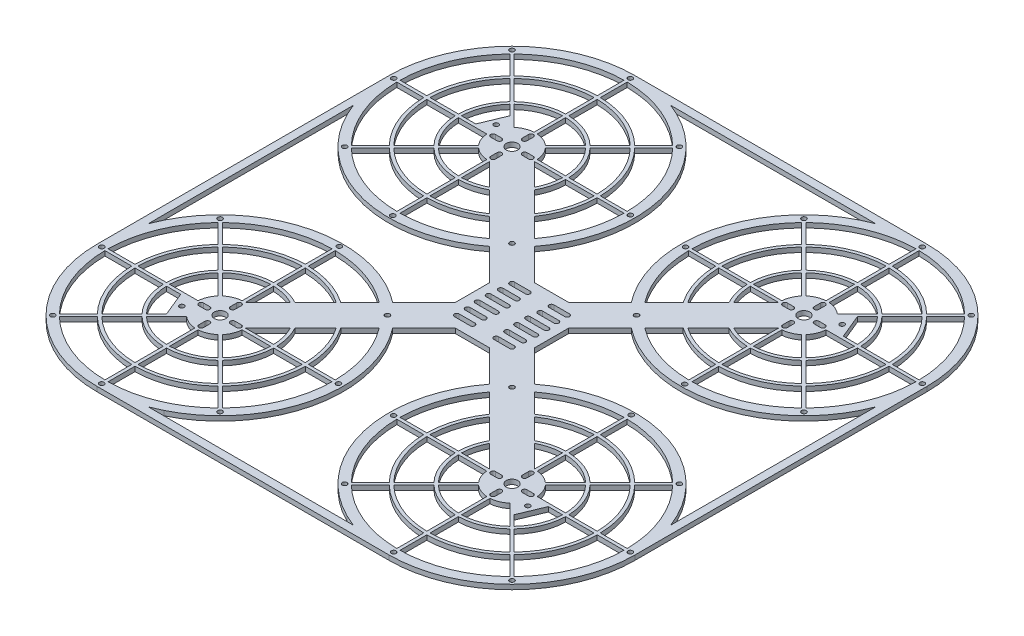
from build123d import *

# Parameters (mm, degrees)
SKETCH_1_R           = 1.5
EXTRUDE_4_DEPTH      = 3
MIRROR_1_OUTLINE_R   = 1.5
MIRROR_1_OUTLINE_R_2 = 3.65
MIRROR_1_DEPTH       = 3


# Read off the part's stored shape, not the designer's step: 镜向1
with BuildPart() as part:
    # 草图1 → 凸台-拉伸4 (new body)
    with BuildSketch(Plane(origin=(0, 0, 0), x_dir=(1, 0, 0), z_dir=(0, 1, 0))):
        with BuildLine():
            Line((67.5, -81.642135624), (67.5, -92.5))
            Line((67.5, -92.5), (92.5, -92.5))
            Line((92.5, -92.5), (92.5, -67.5))
            Line((92.5, -67.5), (81.642135624, -67.5))
            Line((81.642135624, -67.5), (61.770245137, -47.628109513))
            ThreePointArc((61.770245137, -47.628109513), (75.978863612, 17.641209829), (34.465042007, 69.972572337))
            Line((34.465042007, 69.972572337), (27.477263328, 73))
            Line((27.477263328, 73), (92.5, 73))
            Line((92.5, 73), (92.5, 78))
            Line((92.5, 78), (0, 78))
            ThreePointArc((0, 78), (-55.154328933, 55.154328933), (-78, 0))
            Line((-78, 0), (-78, -92.5))
            Line((-78, -92.5), (-73, -92.5))
            Line((-73, -92.5), (-73, -27.477263328))
            ThreePointArc((-73, -27.477263328), (-21.3292137, -75.027092726), (47.628109513, -61.770245137))
            Line((47.628109513, -61.770245137), (67.5, -81.642135624))
        make_face()
        with Locations(Location((-53.033008589, -53.033008589, 0), (0, 0, 270))):
            Circle(SKETCH_1_R, mode=Mode.SUBTRACT)
        with Locations(Location((0, -75.549453739, 0), (0, 0, 270))):
            Circle(SKETCH_1_R, mode=Mode.SUBTRACT)
        with BuildLine():
            ThreePointArc((-38.177337409, -39.591550972), (-21.04758878, -50.813374288), (-1, -54.990908339))
            Line((-1, -54.990908339), (-1, -71.993055221))
            ThreePointArc((-1, -71.993055221), (-27.55320713, -66.519326341), (-50.199670764, -51.613884326))
            Line((-50.199670764, -51.613884326), (-38.177337409, -39.591550972))
        make_face(mode=Mode.SUBTRACT)
        with BuildLine():
            Line((-71.993055221, -1), (-54.990908339, -1))
            ThreePointArc((-54.990908339, -1), (-50.813374288, -21.04758878), (-39.591550972, -38.177337409))
            Line((-39.591550972, -38.177337409), (-51.613884326, -50.199670764))
            ThreePointArc((-51.613884326, -50.199670764), (-66.519326341, -27.55320713), (-71.993055221, -1))
        make_face(mode=Mode.SUBTRACT)
        with BuildLine():
            Line((-25.445740535, -24.031526973), (-38.177094772, -36.762881209))
            ThreePointArc((-38.177094772, -36.762881209), (-48.965615223, -20.282221915), (-52.990565198, -1))
            Line((-52.990565198, -1), (-34.985711369, -1))
            ThreePointArc((-34.985711369, -1), (-32.335783638, -13.393920133), (-25.445740535, -24.031526973))
        make_face(mode=Mode.SUBTRACT)
        with BuildLine():
            ThreePointArc((-24.031526973, -25.445740535), (-13.393920133, -32.335783638), (-1, -34.985711369))
            Line((-1, -34.985711369), (-1, -52.990565198))
            ThreePointArc((-1, -52.990565198), (-20.282221915, -48.965615223), (-36.762881209, -38.177094772))
            Line((-36.762881209, -38.177094772), (-24.031526973, -25.445740535))
        make_face(mode=Mode.SUBTRACT)
        with BuildLine():
            Line((-11.290112025, -9.875898463), (-24.030914361, -22.616700798))
            ThreePointArc((-24.030914361, -22.616700798), (-30.488024573, -12.628553268), (-32.984845005, -1))
            Line((-32.984845005, -1), (-14.966629547, -1))
            ThreePointArc((-14.966629547, -1), (-13.858192988, -5.740251485), (-11.290112025, -9.875898463))
        make_face(mode=Mode.SUBTRACT)
        with BuildLine():
            ThreePointArc((-1, -32.984845005), (-12.628553268, -30.488024573), (-22.616700798, -24.030914361))
            Line((-22.616700798, -24.030914361), (-9.875898463, -11.290112025))
            ThreePointArc((-9.875898463, -11.290112025), (-5.740251485, -13.858192988), (-1, -14.966629547))
            Line((-1, -14.966629547), (-1, -32.984845005))
        make_face(mode=Mode.SUBTRACT)
        with BuildLine():
            ThreePointArc((-1.5, -8), (-1.060660172, -6.939339828), (0, -6.5))
            ThreePointArc((0, -6.5), (1.060660172, -6.939339828), (1.5, -8))
            Line((1.5, -8), (1.5, -12))
            ThreePointArc((1.5, -12), (0, -13.5), (-1.5, -12))
            Line((-1.5, -12), (-1.5, -8))
        make_face(mode=Mode.SUBTRACT)
        with BuildLine():
            Line((31.17157854, -45.313714164), (43.347182852, -57.489318476))
            ThreePointArc((43.347182852, -57.489318476), (23.32933243, -68.115653475), (1, -71.993055221))
            Line((1, -71.993055221), (1, -54.990908339))
            ThreePointArc((1, -54.990908339), (16.79775694, -52.372085712), (31.17157854, -45.313714164))
        make_face(mode=Mode.SUBTRACT)
        with BuildLine():
            ThreePointArc((74.13828427, -90.5), (72.63828427, -89), (74.13828427, -87.5))
            Line((74.13828427, -87.5), (85.86171573, -87.5))
            ThreePointArc((85.86171573, -87.5), (87.36171573, -89), (85.86171573, -90.5))
            Line((85.86171573, -90.5), (74.13828427, -90.5))
        make_face(mode=Mode.SUBTRACT)
        with BuildLine():
            ThreePointArc((74.82170617, -83.5), (73.32170617, -82), (74.82170617, -80.5))
            Line((74.82170617, -80.5), (85.17829383, -80.5))
            ThreePointArc((85.17829383, -80.5), (86.67829383, -82), (85.17829383, -83.5))
            Line((85.17829383, -83.5), (74.82170617, -83.5))
        make_face(mode=Mode.SUBTRACT)
        with BuildLine():
            ThreePointArc((75, -76.5), (73.5, -75), (75, -73.5))
            Line((75, -73.5), (85, -73.5))
            ThreePointArc((85, -73.5), (86.5, -75), (85, -76.5))
            Line((85, -76.5), (75, -76.5))
        make_face(mode=Mode.SUBTRACT)
        with Locations(Location((53.033008589, -53.033008589, 0), (0, 0, 270))):
            Circle(SKETCH_1_R, mode=Mode.SUBTRACT)
        with BuildLine():
            Line((16.646014639, -30.788150263), (29.732464627, -43.874600251))
            ThreePointArc((29.732464627, -43.874600251), (16.027984893, -50.518350134), (1, -52.990565198))
            Line((1, -52.990565198), (1, -34.985711369))
            ThreePointArc((1, -34.985711369), (9.069197207, -33.804580489), (16.646014639, -30.788150263))
        make_face(mode=Mode.SUBTRACT)
        with BuildLine():
            Line((1, -15.142135624), (15.166288146, -29.30842377))
            ThreePointArc((15.166288146, -29.30842377), (8.289525703, -31.941881028), (1, -32.984845005))
            Line((1, -32.984845005), (1, -15.142135624))
        make_face(mode=Mode.SUBTRACT)
        with BuildLine():
            ThreePointArc((32.984845005, -1), (31.941881028, -8.289525703), (29.30842377, -15.166288146))
            Line((29.30842377, -15.166288146), (15.142135624, -1))
            Line((15.142135624, -1), (32.984845005, -1))
        make_face(mode=Mode.SUBTRACT)
        with BuildLine():
            ThreePointArc((52.990565198, -1), (50.518350134, -16.027984893), (43.874600251, -29.732464627))
            Line((43.874600251, -29.732464627), (30.788150263, -16.646014639))
            ThreePointArc((30.788150263, -16.646014639), (33.804580489, -9.069197207), (34.985711369, -1))
            Line((34.985711369, -1), (52.990565198, -1))
        make_face(mode=Mode.SUBTRACT)
        with BuildLine():
            ThreePointArc((71.993055221, -1), (68.115653475, -23.32933243), (57.489318476, -43.347182852))
            Line((57.489318476, -43.347182852), (45.313714164, -31.17157854))
            ThreePointArc((45.313714164, -31.17157854), (52.372085712, -16.79775694), (54.990908339, -1))
            Line((54.990908339, -1), (71.993055221, -1))
        make_face(mode=Mode.SUBTRACT)
        with Locations(Location((-75, 0, 0), (0, 0, 270))):
            Circle(SKETCH_1_R, mode=Mode.SUBTRACT)
        with BuildLine():
            ThreePointArc((-25.445740535, 24.031526973), (-32.335783638, 13.393920133), (-34.985711369, 1))
            Line((-34.985711369, 1), (-52.990565198, 1))
            ThreePointArc((-52.990565198, 1), (-48.965615223, 20.282221915), (-38.177094772, 36.762881209))
            Line((-38.177094772, 36.762881209), (-25.445740535, 24.031526973))
        make_face(mode=Mode.SUBTRACT)
        with BuildLine():
            ThreePointArc((-39.591550972, 38.177337409), (-50.813374288, 21.04758878), (-54.990908339, 1))
            Line((-54.990908339, 1), (-71.993055221, 1))
            ThreePointArc((-71.993055221, 1), (-66.519326341, 27.55320713), (-51.613884326, 50.199670764))
            Line((-51.613884326, 50.199670764), (-39.591550972, 38.177337409))
        make_face(mode=Mode.SUBTRACT)
        with BuildLine():
            Line((-24.030914361, 22.616700798), (-17.660513193, 16.246299631))
            Line((-17.660513193, 16.246299631), (-23.975737276, 1))
            Line((-23.975737276, 1), (-32.984845005, 1))
            ThreePointArc((-32.984845005, 1), (-30.488024573, 12.628553268), (-24.030914361, 22.616700798))
        make_face(mode=Mode.SUBTRACT)
        with BuildLine():
            ThreePointArc((-8, 1.5), (-6.939339828, 1.060660172), (-6.5, 0))
            ThreePointArc((-6.5, 0), (-6.939339828, -1.060660172), (-8, -1.5))
            Line((-8, -1.5), (-12, -1.5))
            ThreePointArc((-12, -1.5), (-13.5, 0), (-12, 1.5))
            Line((-12, 1.5), (-8, 1.5))
        make_face(mode=Mode.SUBTRACT)
        with BuildLine():
            ThreePointArc((3.65, 0), (2.580939751, -2.580939751), (0, -3.65))
            ThreePointArc((0, -3.65), (-2.580939751, -2.580939751), (-3.65, 0))
            ThreePointArc((-3.65, 0), (-2.580939751, 2.580939751), (0, 3.65))
            ThreePointArc((0, 3.65), (2.580939751, 2.580939751), (3.65, 0))
        make_face(mode=Mode.SUBTRACT)
        with BuildLine():
            ThreePointArc((1.5, 8), (1.060660172, 6.939339828), (0, 6.5))
            ThreePointArc((0, 6.5), (-1.060660172, 6.939339828), (-1.5, 8))
            Line((-1.5, 8), (-1.5, 12))
            ThreePointArc((-1.5, 12), (0, 13.5), (1.5, 12))
            Line((1.5, 12), (1.5, 8))
        make_face(mode=Mode.SUBTRACT)
        with BuildLine():
            ThreePointArc((-1, 14.966629547), (-5.740251485, 13.858192988), (-9.875898463, 11.290112025))
            Line((-9.875898463, 11.290112025), (-22.616700798, 24.030914361))
            ThreePointArc((-22.616700798, 24.030914361), (-12.628553268, 30.488024573), (-1, 32.984845005))
            Line((-1, 32.984845005), (-1, 14.966629547))
        make_face(mode=Mode.SUBTRACT)
        with Locations(Location((-53.033008589, 53.033008589, 0), (0, 0, 270))):
            Circle(SKETCH_1_R, mode=Mode.SUBTRACT)
        with BuildLine():
            Line((-1, 52.990565198), (-1, 34.985711369))
            ThreePointArc((-1, 34.985711369), (-13.393920133, 32.335783638), (-24.031526973, 25.445740535))
            Line((-24.031526973, 25.445740535), (-36.762881209, 38.177094772))
            ThreePointArc((-36.762881209, 38.177094772), (-20.282221915, 48.965615223), (-1, 52.990565198))
        make_face(mode=Mode.SUBTRACT)
        with BuildLine():
            Line((-1, 71.993055221), (-1, 54.990908339))
            ThreePointArc((-1, 54.990908339), (-21.04758878, 50.813374288), (-38.177337409, 39.591550972))
            Line((-38.177337409, 39.591550972), (-50.199670764, 51.613884326))
            ThreePointArc((-50.199670764, 51.613884326), (-27.55320713, 66.519326341), (-1, 71.993055221))
        make_face(mode=Mode.SUBTRACT)
        with Locations(Location((0, 75, 0), (0, 0, 270))):
            Circle(SKETCH_1_R, mode=Mode.SUBTRACT)
        with BuildLine():
            ThreePointArc((8, -1.5), (6.939339828, -1.060660172), (6.5, 0))
            ThreePointArc((6.5, 0), (6.939339828, 1.060660172), (8, 1.5))
            Line((8, 1.5), (12, 1.5))
            ThreePointArc((12, 1.5), (13.5, 0), (12, -1.5))
            Line((12, -1.5), (8, -1.5))
        make_face(mode=Mode.SUBTRACT)
        with BuildLine():
            ThreePointArc((14.966629547, 1), (13.858192988, 5.740251485), (11.290112025, 9.875898463))
            Line((11.290112025, 9.875898463), (24.030914361, 22.616700798))
            ThreePointArc((24.030914361, 22.616700798), (30.488024573, 12.628553268), (32.984845005, 1))
            Line((32.984845005, 1), (14.966629547, 1))
        make_face(mode=Mode.SUBTRACT)
        with BuildLine():
            ThreePointArc((1, 32.984845005), (12.628553268, 30.488024573), (22.616700798, 24.030914361))
            Line((22.616700798, 24.030914361), (9.875898463, 11.290112025))
            ThreePointArc((9.875898463, 11.290112025), (5.740251485, 13.858192988), (1, 14.966629547))
            Line((1, 14.966629547), (1, 32.984845005))
        make_face(mode=Mode.SUBTRACT)
        with BuildLine():
            Line((52.990565198, 1), (34.985711369, 1))
            ThreePointArc((34.985711369, 1), (32.335783638, 13.393920133), (25.445740535, 24.031526973))
            Line((25.445740535, 24.031526973), (38.177094772, 36.762881209))
            ThreePointArc((38.177094772, 36.762881209), (48.965615223, 20.282221915), (52.990565198, 1))
        make_face(mode=Mode.SUBTRACT)
        with Locations(Location((75, 0, 0), (0, 0, 270))):
            Circle(SKETCH_1_R, mode=Mode.SUBTRACT)
        with BuildLine():
            Line((71.993055221, 1), (54.990908339, 1))
            ThreePointArc((54.990908339, 1), (50.813374288, 21.04758878), (39.591550972, 38.177337409))
            Line((39.591550972, 38.177337409), (51.613884326, 50.199670764))
            ThreePointArc((51.613884326, 50.199670764), (66.519326341, 27.55320713), (71.993055221, 1))
        make_face(mode=Mode.SUBTRACT)
        with BuildLine():
            ThreePointArc((1, 52.990565198), (20.282221915, 48.965615223), (36.762881209, 38.177094772))
            Line((36.762881209, 38.177094772), (24.031526973, 25.445740535))
            ThreePointArc((24.031526973, 25.445740535), (13.393920133, 32.335783638), (1, 34.985711369))
            Line((1, 34.985711369), (1, 52.990565198))
        make_face(mode=Mode.SUBTRACT)
        with BuildLine():
            Line((1, 54.990908339), (1, 71.993055221))
            ThreePointArc((1, 71.993055221), (27.55320713, 66.519326341), (50.199670764, 51.613884326))
            Line((50.199670764, 51.613884326), (38.177337409, 39.591550972))
            ThreePointArc((38.177337409, 39.591550972), (21.04758878, 50.813374288), (1, 54.990908339))
        make_face(mode=Mode.SUBTRACT)
        with Locations(Location((53.033008589, 53.033008589, 0), (0, 0, 270))):
            Circle(SKETCH_1_R, mode=Mode.SUBTRACT)
        with Locations(Location((-17.122607104, 7.092416086, 0), (0, 0, 270))):
            Circle(SKETCH_1_R, mode=Mode.SUBTRACT)
    extrude(amount=EXTRUDE_4_DEPTH)

    # 镜向1 outline → 镜向1 (add)
    with BuildSketch(Plane(origin=(0, 0, 0), x_dir=(1, 0, 0), z_dir=(0, 1, 0))):
        with BuildLine():
            Line((92.5, 73), (157.522736672, 73))
            Line((157.522736672, 73), (150.534957993, 69.972572337))
            ThreePointArc((150.534957993, 69.972572337), (109.021136388, 17.641209828), (123.229754863, -47.628109513))
            Line((123.229754863, -47.628109513), (103.357864376, -67.5))
            Line((103.357864376, -67.5), (92.5, -67.5))
            Line((92.5, -67.5), (92.5, -92.5))
            Line((92.5, -92.5), (67.5, -92.5))
            Line((67.5, -92.5), (67.5, -103.357864376))
            Line((67.5, -103.357864376), (47.628109513, -123.229754863))
            ThreePointArc((47.628109513, -123.229754863), (-21.3292137, -109.972907274), (-73, -157.522736672))
            Line((-73, -157.522736672), (-73, -92.5))
            Line((-73, -92.5), (-78, -92.5))
            Line((-78, -92.5), (-78, -185))
            ThreePointArc((-78, -185), (-55.154328933, -240.154328933), (0, -263))
            Line((0, -263), (185, -263))
            ThreePointArc((185, -263), (240.154328933, -240.154328933), (263, -185))
            Line((263, -185), (263, 0))
            ThreePointArc((263, 0), (240.154328933, 55.154328933), (185, 78))
            Line((185, 78), (92.5, 78))
            Line((92.5, 78), (92.5, 73))
        make_face()
        with Locations((-53.033008589, -238.033008589)):
            Circle(MIRROR_1_OUTLINE_R, mode=Mode.SUBTRACT)
        with Locations((0, -260)):
            Circle(MIRROR_1_OUTLINE_R, mode=Mode.SUBTRACT)
        with BuildLine():
            Line((-1, -239.990908339), (-1, -256.993055221))
            ThreePointArc((-1, -256.993055221), (-27.55320713, -251.519326341), (-50.199670764, -236.613884326))
            Line((-50.199670764, -236.613884326), (-38.177337409, -224.591550972))
            ThreePointArc((-38.177337409, -224.591550972), (-21.04758878, -235.813374288), (-1, -239.990908339))
        make_face(mode=Mode.SUBTRACT)
        with BuildLine():
            Line((-1, -219.985711369), (-1, -237.990565198))
            ThreePointArc((-1, -237.990565198), (-20.282221915, -233.965615223), (-36.762881209, -223.177094772))
            Line((-36.762881209, -223.177094772), (-24.031526973, -210.445740535))
            ThreePointArc((-24.031526973, -210.445740535), (-13.393920133, -217.335783638), (-1, -219.985711369))
        make_face(mode=Mode.SUBTRACT)
        with BuildLine():
            ThreePointArc((-51.613884326, -235.199670764), (-66.519326341, -212.55320713), (-71.993055221, -186))
            Line((-71.993055221, -186), (-54.990908339, -186))
            ThreePointArc((-54.990908339, -186), (-50.813374288, -206.04758878), (-39.591550972, -223.177337409))
            Line((-39.591550972, -223.177337409), (-51.613884326, -235.199670764))
        make_face(mode=Mode.SUBTRACT)
        with BuildLine():
            ThreePointArc((-38.177094772, -221.762881209), (-48.965615223, -205.282221915), (-52.990565198, -186))
            Line((-52.990565198, -186), (-34.985711369, -186))
            ThreePointArc((-34.985711369, -186), (-32.335783638, -198.393920133), (-25.445740535, -209.031526973))
            Line((-25.445740535, -209.031526973), (-38.177094772, -221.762881209))
        make_face(mode=Mode.SUBTRACT)
        with Locations((-75, -185)):
            Circle(MIRROR_1_OUTLINE_R, mode=Mode.SUBTRACT)
        with BuildLine():
            Line((-1, -199.966629547), (-1, -217.984845005))
            ThreePointArc((-1, -217.984845005), (-12.628553268, -215.488024573), (-22.616700798, -209.030914361))
            Line((-22.616700798, -209.030914361), (-9.875898463, -196.290112025))
            ThreePointArc((-9.875898463, -196.290112025), (-5.740251486, -198.858192988), (-1, -199.966629547))
        make_face(mode=Mode.SUBTRACT)
        with BuildLine():
            Line((-17.660513193, -201.246299631), (-24.030914361, -207.616700798))
            ThreePointArc((-24.030914361, -207.616700798), (-30.488024573, -197.628553268), (-32.984845005, -186))
            Line((-32.984845005, -186), (-23.975737276, -186))
            Line((-23.975737276, -186), (-17.660513193, -201.246299631))
        make_face(mode=Mode.SUBTRACT)
        with Locations((-17.122607104, -192.092416086)):
            Circle(MIRROR_1_OUTLINE_R, mode=Mode.SUBTRACT)
        with BuildLine():
            ThreePointArc((-1.5, -193), (0, -191.5), (1.5, -193))
            Line((1.5, -193), (1.5, -197))
            ThreePointArc((1.5, -197), (0, -198.5), (-1.5, -197))
            Line((-1.5, -197), (-1.5, -193))
        make_face(mode=Mode.SUBTRACT)
        with BuildLine():
            ThreePointArc((-12, -186.5), (-13.5, -185), (-12, -183.5))
            Line((-12, -183.5), (-8, -183.5))
            ThreePointArc((-8, -183.5), (-6.5, -185), (-8, -186.5))
            Line((-8, -186.5), (-12, -186.5))
        make_face(mode=Mode.SUBTRACT)
        with Locations((0, -185)):
            Circle(MIRROR_1_OUTLINE_R_2, mode=Mode.SUBTRACT)
        with BuildLine():
            Line((1, -256.993055221), (1, -239.990908339))
            ThreePointArc((1, -239.990908339), (21.04758878, -235.813374288), (38.177337409, -224.591550972))
            Line((38.177337409, -224.591550972), (50.199670764, -236.613884326))
            ThreePointArc((50.199670764, -236.613884326), (27.55320713, -251.519326341), (1, -256.993055221))
        make_face(mode=Mode.SUBTRACT)
        with BuildLine():
            Line((1, -237.990565198), (1, -219.985711369))
            ThreePointArc((1, -219.985711369), (13.393920133, -217.335783638), (24.031526973, -210.445740535))
            Line((24.031526973, -210.445740535), (36.762881209, -223.177094772))
            ThreePointArc((36.762881209, -223.177094772), (20.282221915, -233.965615223), (1, -237.990565198))
        make_face(mode=Mode.SUBTRACT)
        with Locations((53.033008589, -238.033008589)):
            Circle(MIRROR_1_OUTLINE_R, mode=Mode.SUBTRACT)
        with BuildLine():
            Line((1, -217.984845005), (1, -199.966629547))
            ThreePointArc((1, -199.966629547), (5.740251486, -198.858192988), (9.875898463, -196.290112025))
            Line((9.875898463, -196.290112025), (22.616700798, -209.030914361))
            ThreePointArc((22.616700798, -209.030914361), (12.628553268, -215.488024573), (1, -217.984845005))
        make_face(mode=Mode.SUBTRACT)
        with BuildLine():
            Line((34.985711369, -186), (52.990565198, -186))
            ThreePointArc((52.990565198, -186), (48.965615223, -205.282221915), (38.177094772, -221.762881209))
            Line((38.177094772, -221.762881209), (25.445740535, -209.031526973))
            ThreePointArc((25.445740535, -209.031526973), (32.335783638, -198.393920133), (34.985711369, -186))
        make_face(mode=Mode.SUBTRACT)
        with BuildLine():
            Line((14.966629547, -186), (32.984845005, -186))
            ThreePointArc((32.984845005, -186), (30.488024573, -197.628553268), (24.030914361, -207.616700798))
            Line((24.030914361, -207.616700798), (11.290112025, -194.875898463))
            ThreePointArc((11.290112025, -194.875898463), (13.858192988, -190.740251486), (14.966629547, -186))
        make_face(mode=Mode.SUBTRACT)
        with BuildLine():
            Line((8, -183.5), (12, -183.5))
            ThreePointArc((12, -183.5), (13.5, -185), (12, -186.5))
            Line((12, -186.5), (8, -186.5))
            ThreePointArc((8, -186.5), (6.5, -185), (8, -183.5))
        make_face(mode=Mode.SUBTRACT)
        with BuildLine():
            Line((54.990908339, -186), (71.993055221, -186))
            ThreePointArc((71.993055221, -186), (66.519326341, -212.55320713), (51.613884326, -235.199670764))
            Line((51.613884326, -235.199670764), (39.591550972, -223.177337409))
            ThreePointArc((39.591550972, -223.177337409), (50.813374288, -206.04758878), (54.990908339, -186))
        make_face(mode=Mode.SUBTRACT)
        with Locations((75, -185)):
            Circle(MIRROR_1_OUTLINE_R, mode=Mode.SUBTRACT)
        with BuildLine():
            Line((-54.990908339, -184), (-71.993055221, -184))
            ThreePointArc((-71.993055221, -184), (-66.519326341, -157.44679287), (-51.613884326, -134.800329236))
            Line((-51.613884326, -134.800329236), (-39.591550972, -146.822662591))
            ThreePointArc((-39.591550972, -146.822662591), (-50.813374288, -163.95241122), (-54.990908339, -184))
        make_face(mode=Mode.SUBTRACT)
        with BuildLine():
            Line((-34.985711369, -184), (-52.990565198, -184))
            ThreePointArc((-52.990565198, -184), (-48.965615223, -164.717778085), (-38.177094772, -148.237118791))
            Line((-38.177094772, -148.237118791), (-25.445740535, -160.968473027))
            ThreePointArc((-25.445740535, -160.968473027), (-32.335783638, -171.606079867), (-34.985711369, -184))
        make_face(mode=Mode.SUBTRACT)
        with BuildLine():
            Line((-14.966629547, -184), (-32.984845005, -184))
            ThreePointArc((-32.984845005, -184), (-30.488024573, -172.371446732), (-24.030914361, -162.383299202))
            Line((-24.030914361, -162.383299202), (-11.290112025, -175.124101537))
            ThreePointArc((-11.290112025, -175.124101537), (-13.858192988, -179.259748514), (-14.966629547, -184))
        make_face(mode=Mode.SUBTRACT)
        with BuildLine():
            ThreePointArc((-1.5, -173), (0, -171.5), (1.5, -173))
            Line((1.5, -173), (1.5, -177))
            ThreePointArc((1.5, -177), (0, -178.5), (-1.5, -177))
            Line((-1.5, -177), (-1.5, -173))
        make_face(mode=Mode.SUBTRACT)
        with BuildLine():
            ThreePointArc((-22.616700798, -160.969085639), (-12.628553268, -154.511975427), (-1, -152.015154995))
            Line((-1, -152.015154995), (-1, -170.033370453))
            ThreePointArc((-1, -170.033370453), (-5.740251486, -171.141807012), (-9.875898463, -173.709887975))
            Line((-9.875898463, -173.709887975), (-22.616700798, -160.969085639))
        make_face(mode=Mode.SUBTRACT)
        with BuildLine():
            ThreePointArc((-36.762881209, -146.822905228), (-20.282221915, -136.034384777), (-1, -132.009434802))
            Line((-1, -132.009434802), (-1, -150.014288631))
            ThreePointArc((-1, -150.014288631), (-13.393920133, -152.664216362), (-24.031526973, -159.554259465))
            Line((-24.031526973, -159.554259465), (-36.762881209, -146.822905228))
        make_face(mode=Mode.SUBTRACT)
        with Locations((-53.033008589, -131.966991411)):
            Circle(MIRROR_1_OUTLINE_R, mode=Mode.SUBTRACT)
        with BuildLine():
            ThreePointArc((-50.199670764, -133.386115674), (-27.55320713, -118.480673659), (-1, -113.006944779))
            Line((-1, -113.006944779), (-1, -130.009091661))
            ThreePointArc((-1, -130.009091661), (-21.04758878, -134.186625712), (-38.177337409, -145.408449028))
            Line((-38.177337409, -145.408449028), (-50.199670764, -133.386115674))
        make_face(mode=Mode.SUBTRACT)
        with Locations((0, -109.450546261)):
            Circle(MIRROR_1_OUTLINE_R, mode=Mode.SUBTRACT)
        with BuildLine():
            Line((15.142135624, -184), (29.30842377, -169.833711854))
            ThreePointArc((29.30842377, -169.833711854), (31.941881028, -176.710474297), (32.984845005, -184))
            Line((32.984845005, -184), (15.142135624, -184))
        make_face(mode=Mode.SUBTRACT)
        with BuildLine():
            Line((1, -169.857864376), (1, -152.015154995))
            ThreePointArc((1, -152.015154995), (8.289525703, -153.058118972), (15.166288146, -155.69157623))
            Line((15.166288146, -155.69157623), (1, -169.857864376))
        make_face(mode=Mode.SUBTRACT)
        with BuildLine():
            ThreePointArc((43.874600251, -155.267535373), (50.518350134, -168.972015107), (52.990565198, -184))
            Line((52.990565198, -184), (34.985711369, -184))
            ThreePointArc((34.985711369, -184), (33.804580489, -175.930802793), (30.788150263, -168.353985361))
            Line((30.788150263, -168.353985361), (43.874600251, -155.267535373))
        make_face(mode=Mode.SUBTRACT)
        with BuildLine():
            Line((1, -150.014288631), (1, -132.009434802))
            ThreePointArc((1, -132.009434802), (16.027984893, -134.481649866), (29.732464627, -141.125399749))
            Line((29.732464627, -141.125399749), (16.646014639, -154.211849737))
            ThreePointArc((16.646014639, -154.211849737), (9.069197207, -151.195419511), (1, -150.014288631))
        make_face(mode=Mode.SUBTRACT)
        with BuildLine():
            ThreePointArc((57.489318476, -141.652817148), (68.115653475, -161.67066757), (71.993055221, -184))
            Line((71.993055221, -184), (54.990908339, -184))
            ThreePointArc((54.990908339, -184), (52.372085712, -168.20224306), (45.313714164, -153.82842146))
            Line((45.313714164, -153.82842146), (57.489318476, -141.652817148))
        make_face(mode=Mode.SUBTRACT)
        with BuildLine():
            Line((1, -130.009091661), (1, -113.006944779))
            ThreePointArc((1, -113.006944779), (23.32933243, -116.884346525), (43.347182852, -127.510681524))
            Line((43.347182852, -127.510681524), (31.17157854, -139.686285836))
            ThreePointArc((31.17157854, -139.686285836), (16.79775694, -132.627914288), (1, -130.009091661))
        make_face(mode=Mode.SUBTRACT)
        with Locations((53.033008589, -131.966991411)):
            Circle(MIRROR_1_OUTLINE_R, mode=Mode.SUBTRACT)
        with BuildLine():
            Line((75, -108.5), (85, -108.5))
            ThreePointArc((85, -108.5), (86.5, -110), (85, -111.5))
            Line((85, -111.5), (75, -111.5))
            ThreePointArc((75, -111.5), (73.5, -110), (75, -108.5))
        make_face(mode=Mode.SUBTRACT)
        with BuildLine():
            Line((74.82170617, -101.5), (85.17829383, -101.5))
            ThreePointArc((85.17829383, -101.5), (86.67829383, -103), (85.17829383, -104.5))
            Line((85.17829383, -104.5), (74.82170617, -104.5))
            ThreePointArc((74.82170617, -104.5), (73.32170617, -103), (74.82170617, -101.5))
        make_face(mode=Mode.SUBTRACT)
        with BuildLine():
            Line((74.13828427, -94.5), (85.86171573, -94.5))
            ThreePointArc((85.86171573, -94.5), (87.36171573, -96), (85.86171573, -97.5))
            Line((85.86171573, -97.5), (74.13828427, -97.5))
            ThreePointArc((74.13828427, -97.5), (72.63828427, -96), (74.13828427, -94.5))
        make_face(mode=Mode.SUBTRACT)
        with Locations((131.966991411, -238.033008589)):
            Circle(MIRROR_1_OUTLINE_R, mode=Mode.SUBTRACT)
        with BuildLine():
            ThreePointArc((146.822662591, -224.591550972), (163.95241122, -235.813374288), (184, -239.990908339))
            Line((184, -239.990908339), (184, -256.993055221))
            ThreePointArc((184, -256.993055221), (157.44679287, -251.519326341), (134.800329236, -236.613884326))
            Line((134.800329236, -236.613884326), (146.822662591, -224.591550972))
        make_face(mode=Mode.SUBTRACT)
        with BuildLine():
            ThreePointArc((160.968473027, -210.445740535), (171.606079867, -217.335783638), (184, -219.985711369))
            Line((184, -219.985711369), (184, -237.990565198))
            ThreePointArc((184, -237.990565198), (164.717778085, -233.965615223), (148.237118791, -223.177094772))
            Line((148.237118791, -223.177094772), (160.968473027, -210.445740535))
        make_face(mode=Mode.SUBTRACT)
        with BuildLine():
            ThreePointArc((133.386115674, -235.199670764), (118.480673659, -212.55320713), (113.006944779, -186))
            Line((113.006944779, -186), (130.009091661, -186))
            ThreePointArc((130.009091661, -186), (134.186625712, -206.04758878), (145.408449028, -223.177337409))
            Line((145.408449028, -223.177337409), (133.386115674, -235.199670764))
        make_face(mode=Mode.SUBTRACT)
        with BuildLine():
            Line((81.642135624, -117.5), (103.357864376, -117.5))
            Line((103.357864376, -117.5), (123.229754863, -137.371890487))
            ThreePointArc((123.229754863, -137.371890487), (109.021136388, -202.641209828), (150.534957993, -254.972572337))
            Line((150.534957993, -254.972572337), (157.522736672, -258))
            Line((157.522736672, -258), (27.477263328, -258))
            Line((27.477263328, -258), (34.465042007, -254.972572337))
            ThreePointArc((34.465042007, -254.972572337), (75.978863612, -202.641209828), (61.770245137, -137.371890487))
            Line((61.770245137, -137.371890487), (81.642135624, -117.5))
        make_face(mode=Mode.SUBTRACT)
        with Locations((110, -185)):
            Circle(MIRROR_1_OUTLINE_R, mode=Mode.SUBTRACT)
        with BuildLine():
            ThreePointArc((146.822905228, -221.762881209), (136.034384777, -205.282221915), (132.009434802, -186))
            Line((132.009434802, -186), (150.014288631, -186))
            ThreePointArc((150.014288631, -186), (152.664216362, -198.393920133), (159.554259465, -209.031526973))
            Line((159.554259465, -209.031526973), (146.822905228, -221.762881209))
        make_face(mode=Mode.SUBTRACT)
        with BuildLine():
            ThreePointArc((175.124101537, -196.290112025), (179.259748514, -198.858192988), (184, -199.966629547))
            Line((184, -199.966629547), (184, -217.984845005))
            ThreePointArc((184, -217.984845005), (172.371446732, -215.488024573), (162.383299202, -209.030914361))
            Line((162.383299202, -209.030914361), (175.124101537, -196.290112025))
        make_face(mode=Mode.SUBTRACT)
        with BuildLine():
            ThreePointArc((160.969085639, -207.616700798), (154.511975427, -197.628553268), (152.015154995, -186))
            Line((152.015154995, -186), (170.033370453, -186))
            ThreePointArc((170.033370453, -186), (171.141807012, -190.740251486), (173.709887975, -194.875898463))
            Line((173.709887975, -194.875898463), (160.969085639, -207.616700798))
        make_face(mode=Mode.SUBTRACT)
        with BuildLine():
            ThreePointArc((173, -186.5), (171.5, -185), (173, -183.5))
            Line((173, -183.5), (177, -183.5))
            ThreePointArc((177, -183.5), (178.5, -185), (177, -186.5))
            Line((177, -186.5), (173, -186.5))
        make_face(mode=Mode.SUBTRACT)
        with Locations((185, -260)):
            Circle(MIRROR_1_OUTLINE_R, mode=Mode.SUBTRACT)
        with BuildLine():
            Line((223.177337409, -224.591550972), (235.199670764, -236.613884326))
            ThreePointArc((235.199670764, -236.613884326), (212.55320713, -251.519326341), (186, -256.993055221))
            Line((186, -256.993055221), (186, -239.990908339))
            ThreePointArc((186, -239.990908339), (206.04758878, -235.813374288), (223.177337409, -224.591550972))
        make_face(mode=Mode.SUBTRACT)
        with BuildLine():
            Line((209.031526973, -210.445740535), (221.762881209, -223.177094772))
            ThreePointArc((221.762881209, -223.177094772), (205.282221915, -233.965615223), (186, -237.990565198))
            Line((186, -237.990565198), (186, -219.985711369))
            ThreePointArc((186, -219.985711369), (198.393920133, -217.335783638), (209.031526973, -210.445740535))
        make_face(mode=Mode.SUBTRACT)
        with Locations((238.033008589, -238.033008589)):
            Circle(MIRROR_1_OUTLINE_R, mode=Mode.SUBTRACT)
        with BuildLine():
            Line((194.875898463, -196.290112025), (207.616700798, -209.030914361))
            ThreePointArc((207.616700798, -209.030914361), (197.628553268, -215.488024573), (186, -217.984845005))
            Line((186, -217.984845005), (186, -199.966629547))
            ThreePointArc((186, -199.966629547), (190.740251486, -198.858192988), (194.875898463, -196.290112025))
        make_face(mode=Mode.SUBTRACT)
        with BuildLine():
            Line((183.5, -197), (183.5, -193))
            ThreePointArc((183.5, -193), (185, -191.5), (186.5, -193))
            Line((186.5, -193), (186.5, -197))
            ThreePointArc((186.5, -197), (185, -198.5), (183.5, -197))
        make_face(mode=Mode.SUBTRACT)
        with Locations((185, -185)):
            Circle(MIRROR_1_OUTLINE_R_2, mode=Mode.SUBTRACT)
        with BuildLine():
            Line((193, -183.5), (197, -183.5))
            ThreePointArc((197, -183.5), (198.5, -185), (197, -186.5))
            Line((197, -186.5), (193, -186.5))
            ThreePointArc((193, -186.5), (191.5, -185), (193, -183.5))
        make_face(mode=Mode.SUBTRACT)
        with Locations((202.122607104, -192.092416086)):
            Circle(MIRROR_1_OUTLINE_R, mode=Mode.SUBTRACT)
        with BuildLine():
            ThreePointArc((217.984845005, -186), (215.488024573, -197.628553268), (209.030914361, -207.616700798))
            Line((209.030914361, -207.616700798), (202.660513193, -201.246299631))
            Line((202.660513193, -201.246299631), (208.975737276, -186))
            Line((208.975737276, -186), (217.984845005, -186))
        make_face(mode=Mode.SUBTRACT)
        with BuildLine():
            ThreePointArc((256.993055221, -186), (251.519326341, -212.55320713), (236.613884326, -235.199670764))
            Line((236.613884326, -235.199670764), (224.591550972, -223.177337409))
            ThreePointArc((224.591550972, -223.177337409), (235.813374288, -206.04758878), (239.990908339, -186))
            Line((239.990908339, -186), (256.993055221, -186))
        make_face(mode=Mode.SUBTRACT)
        with BuildLine():
            ThreePointArc((237.990565198, -186), (233.965615223, -205.282221915), (223.177094772, -221.762881209))
            Line((223.177094772, -221.762881209), (210.445740535, -209.031526973))
            ThreePointArc((210.445740535, -209.031526973), (217.335783638, -198.393920133), (219.985711369, -186))
            Line((219.985711369, -186), (237.990565198, -186))
        make_face(mode=Mode.SUBTRACT)
        with Locations((260, -185)):
            Circle(MIRROR_1_OUTLINE_R, mode=Mode.SUBTRACT)
        with BuildLine():
            ThreePointArc((113.006944779, -184), (116.884346525, -161.67066757), (127.510681524, -141.652817148))
            Line((127.510681524, -141.652817148), (139.686285836, -153.82842146))
            ThreePointArc((139.686285836, -153.82842146), (132.627914288, -168.20224306), (130.009091661, -184))
            Line((130.009091661, -184), (113.006944779, -184))
        make_face(mode=Mode.SUBTRACT)
        with BuildLine():
            ThreePointArc((132.009434802, -184), (134.481649866, -168.972015107), (141.125399749, -155.267535373))
            Line((141.125399749, -155.267535373), (154.211849737, -168.353985361))
            ThreePointArc((154.211849737, -168.353985361), (151.195419511, -175.930802793), (150.014288631, -184))
            Line((150.014288631, -184), (132.009434802, -184))
        make_face(mode=Mode.SUBTRACT)
        with BuildLine():
            ThreePointArc((152.015154995, -184), (153.058118972, -176.710474297), (155.69157623, -169.833711854))
            Line((155.69157623, -169.833711854), (169.857864376, -184))
            Line((169.857864376, -184), (152.015154995, -184))
        make_face(mode=Mode.SUBTRACT)
        with BuildLine():
            Line((184, -169.857864376), (169.833711854, -155.69157623))
            ThreePointArc((169.833711854, -155.69157623), (176.710474297, -153.058118972), (184, -152.015154995))
            Line((184, -152.015154995), (184, -169.857864376))
        make_face(mode=Mode.SUBTRACT)
        with BuildLine():
            Line((168.353985361, -154.211849737), (155.267535373, -141.125399749))
            ThreePointArc((155.267535373, -141.125399749), (168.972015107, -134.481649866), (184, -132.009434802))
            Line((184, -132.009434802), (184, -150.014288631))
            ThreePointArc((184, -150.014288631), (175.930802793, -151.195419511), (168.353985361, -154.211849737))
        make_face(mode=Mode.SUBTRACT)
        with Locations((131.966991411, -131.966991411)):
            Circle(MIRROR_1_OUTLINE_R, mode=Mode.SUBTRACT)
        with BuildLine():
            Line((110, -111.5), (100, -111.5))
            ThreePointArc((100, -111.5), (98.5, -110), (100, -108.5))
            Line((100, -108.5), (110, -108.5))
            ThreePointArc((110, -108.5), (111.5, -110), (110, -111.5))
        make_face(mode=Mode.SUBTRACT)
        with BuildLine():
            Line((110.17829383, -104.5), (99.82170617, -104.5))
            ThreePointArc((99.82170617, -104.5), (98.32170617, -103), (99.82170617, -101.5))
            Line((99.82170617, -101.5), (110.17829383, -101.5))
            ThreePointArc((110.17829383, -101.5), (111.67829383, -103), (110.17829383, -104.5))
        make_face(mode=Mode.SUBTRACT)
        with BuildLine():
            Line((110.86171573, -97.5), (99.13828427, -97.5))
            ThreePointArc((99.13828427, -97.5), (97.63828427, -96), (99.13828427, -94.5))
            Line((99.13828427, -94.5), (110.86171573, -94.5))
            ThreePointArc((110.86171573, -94.5), (112.36171573, -96), (110.86171573, -97.5))
        make_face(mode=Mode.SUBTRACT)
        with BuildLine():
            Line((153.82842146, -139.686285836), (141.652817148, -127.510681524))
            ThreePointArc((141.652817148, -127.510681524), (161.67066757, -116.884346525), (184, -113.006944779))
            Line((184, -113.006944779), (184, -130.009091661))
            ThreePointArc((184, -130.009091661), (168.20224306, -132.627914288), (153.82842146, -139.686285836))
        make_face(mode=Mode.SUBTRACT)
        with BuildLine():
            Line((183.5, -177), (183.5, -173))
            ThreePointArc((183.5, -173), (185, -171.5), (186.5, -173))
            Line((186.5, -173), (186.5, -177))
            ThreePointArc((186.5, -177), (185, -178.5), (183.5, -177))
        make_face(mode=Mode.SUBTRACT)
        with BuildLine():
            Line((186, -170.033370453), (186, -152.015154995))
            ThreePointArc((186, -152.015154995), (197.628553268, -154.511975427), (207.616700798, -160.969085639))
            Line((207.616700798, -160.969085639), (194.875898463, -173.709887975))
            ThreePointArc((194.875898463, -173.709887975), (190.740251486, -171.141807012), (186, -170.033370453))
        make_face(mode=Mode.SUBTRACT)
        with BuildLine():
            ThreePointArc((209.030914361, -162.383299202), (215.488024573, -172.371446732), (217.984845005, -184))
            Line((217.984845005, -184), (199.966629547, -184))
            ThreePointArc((199.966629547, -184), (198.858192988, -179.259748514), (196.290112025, -175.124101537))
            Line((196.290112025, -175.124101537), (209.030914361, -162.383299202))
        make_face(mode=Mode.SUBTRACT)
        with BuildLine():
            Line((186, -150.014288631), (186, -132.009434802))
            ThreePointArc((186, -132.009434802), (205.282221915, -136.034384777), (221.762881209, -146.822905228))
            Line((221.762881209, -146.822905228), (209.031526973, -159.554259465))
            ThreePointArc((209.031526973, -159.554259465), (198.393920133, -152.664216362), (186, -150.014288631))
        make_face(mode=Mode.SUBTRACT)
        with BuildLine():
            ThreePointArc((223.177094772, -148.237118791), (233.965615223, -164.717778085), (237.990565198, -184))
            Line((237.990565198, -184), (219.985711369, -184))
            ThreePointArc((219.985711369, -184), (217.335783638, -171.606079867), (210.445740535, -160.968473027))
            Line((210.445740535, -160.968473027), (223.177094772, -148.237118791))
        make_face(mode=Mode.SUBTRACT)
        with BuildLine():
            ThreePointArc((236.613884326, -134.800329236), (251.519326341, -157.44679287), (256.993055221, -184))
            Line((256.993055221, -184), (239.990908339, -184))
            ThreePointArc((239.990908339, -184), (235.813374288, -163.95241122), (224.591550972, -146.822662591))
            Line((224.591550972, -146.822662591), (236.613884326, -134.800329236))
        make_face(mode=Mode.SUBTRACT)
        with BuildLine():
            Line((186, -130.009091661), (186, -113.006944779))
            ThreePointArc((186, -113.006944779), (212.55320713, -118.480673659), (235.199670764, -133.386115674))
            Line((235.199670764, -133.386115674), (223.177337409, -145.408449028))
            ThreePointArc((223.177337409, -145.408449028), (206.04758878, -134.186625712), (186, -130.009091661))
        make_face(mode=Mode.SUBTRACT)
        with Locations((185, -109.450546261)):
            Circle(MIRROR_1_OUTLINE_R, mode=Mode.SUBTRACT)
        with Locations((238.033008589, -131.966991411)):
            Circle(MIRROR_1_OUTLINE_R, mode=Mode.SUBTRACT)
        with BuildLine():
            Line((110.86171573, -90.5), (99.13828427, -90.5))
            ThreePointArc((99.13828427, -90.5), (97.63828427, -89), (99.13828427, -87.5))
            Line((99.13828427, -87.5), (110.86171573, -87.5))
            ThreePointArc((110.86171573, -87.5), (112.36171573, -89), (110.86171573, -90.5))
        make_face(mode=Mode.SUBTRACT)
        with BuildLine():
            Line((110.17829383, -83.5), (99.82170617, -83.5))
            ThreePointArc((99.82170617, -83.5), (98.32170617, -82), (99.82170617, -80.5))
            Line((99.82170617, -80.5), (110.17829383, -80.5))
            ThreePointArc((110.17829383, -80.5), (111.67829383, -82), (110.17829383, -83.5))
        make_face(mode=Mode.SUBTRACT)
        with BuildLine():
            Line((110, -76.5), (100, -76.5))
            ThreePointArc((100, -76.5), (98.5, -75), (100, -73.5))
            Line((100, -73.5), (110, -73.5))
            ThreePointArc((110, -73.5), (111.5, -75), (110, -76.5))
        make_face(mode=Mode.SUBTRACT)
        with Locations((131.966991411, -53.033008589)):
            Circle(MIRROR_1_OUTLINE_R, mode=Mode.SUBTRACT)
        with BuildLine():
            ThreePointArc((184, -71.993055221), (161.67066757, -68.115653475), (141.652817148, -57.489318476))
            Line((141.652817148, -57.489318476), (153.82842146, -45.313714164))
            ThreePointArc((153.82842146, -45.313714164), (168.20224306, -52.372085712), (184, -54.990908339))
            Line((184, -54.990908339), (184, -71.993055221))
        make_face(mode=Mode.SUBTRACT)
        with BuildLine():
            ThreePointArc((127.510681524, -43.347182852), (116.884346525, -23.32933243), (113.006944779, -1))
            Line((113.006944779, -1), (130.009091661, -1))
            ThreePointArc((130.009091661, -1), (132.627914288, -16.79775694), (139.686285836, -31.17157854))
            Line((139.686285836, -31.17157854), (127.510681524, -43.347182852))
        make_face(mode=Mode.SUBTRACT)
        with BuildLine():
            ThreePointArc((184, -52.990565198), (168.972015107, -50.518350134), (155.267535373, -43.874600251))
            Line((155.267535373, -43.874600251), (168.353985361, -30.788150263))
            ThreePointArc((168.353985361, -30.788150263), (175.930802793, -33.804580489), (184, -34.985711369))
            Line((184, -34.985711369), (184, -52.990565198))
        make_face(mode=Mode.SUBTRACT)
        with BuildLine():
            ThreePointArc((141.125399749, -29.732464627), (134.481649866, -16.027984893), (132.009434802, -1))
            Line((132.009434802, -1), (150.014288631, -1))
            ThreePointArc((150.014288631, -1), (151.195419511, -9.069197207), (154.211849737, -16.646014639))
            Line((154.211849737, -16.646014639), (141.125399749, -29.732464627))
        make_face(mode=Mode.SUBTRACT)
        with BuildLine():
            ThreePointArc((184, -32.984845005), (176.710474297, -31.941881028), (169.833711854, -29.30842377))
            Line((169.833711854, -29.30842377), (184, -15.142135624))
            Line((184, -15.142135624), (184, -32.984845005))
        make_face(mode=Mode.SUBTRACT)
        with BuildLine():
            ThreePointArc((155.69157623, -15.166288146), (153.058118972, -8.289525703), (152.015154995, -1))
            Line((152.015154995, -1), (169.857864376, -1))
            Line((169.857864376, -1), (155.69157623, -15.166288146))
        make_face(mode=Mode.SUBTRACT)
        with BuildLine():
            Line((137.371890487, -123.229754863), (117.5, -103.357864376))
            Line((117.5, -103.357864376), (117.5, -81.642135624))
            Line((117.5, -81.642135624), (137.371890487, -61.770245137))
            ThreePointArc((137.371890487, -61.770245137), (206.3292137, -75.027092726), (258, -27.477263328))
            Line((258, -27.477263328), (258, -157.522736672))
            ThreePointArc((258, -157.522736672), (206.3292137, -109.972907274), (137.371890487, -123.229754863))
        make_face(mode=Mode.SUBTRACT)
        with Locations((185, -75.549453739)):
            Circle(MIRROR_1_OUTLINE_R, mode=Mode.SUBTRACT)
        with BuildLine():
            ThreePointArc((235.199670764, -51.613884326), (212.55320713, -66.519326341), (186, -71.993055221))
            Line((186, -71.993055221), (186, -54.990908339))
            ThreePointArc((186, -54.990908339), (206.04758878, -50.813374288), (223.177337409, -39.591550972))
            Line((223.177337409, -39.591550972), (235.199670764, -51.613884326))
        make_face(mode=Mode.SUBTRACT)
        with Locations((238.033008589, -53.033008589)):
            Circle(MIRROR_1_OUTLINE_R, mode=Mode.SUBTRACT)
        with BuildLine():
            ThreePointArc((221.762881209, -38.177094772), (205.282221915, -48.965615223), (186, -52.990565198))
            Line((186, -52.990565198), (186, -34.985711369))
            ThreePointArc((186, -34.985711369), (198.393920133, -32.335783638), (209.031526973, -25.445740535))
            Line((209.031526973, -25.445740535), (221.762881209, -38.177094772))
        make_face(mode=Mode.SUBTRACT)
        with BuildLine():
            ThreePointArc((207.616700798, -24.030914361), (197.628553268, -30.488024573), (186, -32.984845005))
            Line((186, -32.984845005), (186, -14.966629547))
            ThreePointArc((186, -14.966629547), (190.740251486, -13.858192988), (194.875898463, -11.290112025))
            Line((194.875898463, -11.290112025), (207.616700798, -24.030914361))
        make_face(mode=Mode.SUBTRACT)
        with BuildLine():
            ThreePointArc((186.5, -12), (185, -13.5), (183.5, -12))
            Line((183.5, -12), (183.5, -8))
            ThreePointArc((183.5, -8), (185, -6.5), (186.5, -8))
            Line((186.5, -8), (186.5, -12))
        make_face(mode=Mode.SUBTRACT)
        with BuildLine():
            Line((199.966629547, -1), (217.984845005, -1))
            ThreePointArc((217.984845005, -1), (215.488024573, -12.628553268), (209.030914361, -22.616700798))
            Line((209.030914361, -22.616700798), (196.290112025, -9.875898463))
            ThreePointArc((196.290112025, -9.875898463), (198.858192988, -5.740251486), (199.966629547, -1))
        make_face(mode=Mode.SUBTRACT)
        with BuildLine():
            Line((219.985711369, -1), (237.990565198, -1))
            ThreePointArc((237.990565198, -1), (233.965615223, -20.282221915), (223.177094772, -36.762881209))
            Line((223.177094772, -36.762881209), (210.445740535, -24.031526973))
            ThreePointArc((210.445740535, -24.031526973), (217.335783638, -13.393920133), (219.985711369, -1))
        make_face(mode=Mode.SUBTRACT)
        with BuildLine():
            Line((239.990908339, -1), (256.993055221, -1))
            ThreePointArc((256.993055221, -1), (251.519326341, -27.55320713), (236.613884326, -50.199670764))
            Line((236.613884326, -50.199670764), (224.591550972, -38.177337409))
            ThreePointArc((224.591550972, -38.177337409), (235.813374288, -21.04758878), (239.990908339, -1))
        make_face(mode=Mode.SUBTRACT)
        with Locations((110, 0)):
            Circle(MIRROR_1_OUTLINE_R, mode=Mode.SUBTRACT)
        with BuildLine():
            Line((130.009091661, 1), (113.006944779, 1))
            ThreePointArc((113.006944779, 1), (118.480673659, 27.55320713), (133.386115674, 50.199670764))
            Line((133.386115674, 50.199670764), (145.408449028, 38.177337409))
            ThreePointArc((145.408449028, 38.177337409), (134.186625712, 21.04758878), (130.009091661, 1))
        make_face(mode=Mode.SUBTRACT)
        with BuildLine():
            Line((177, -1.5), (173, -1.5))
            ThreePointArc((173, -1.5), (171.5, 0), (173, 1.5))
            Line((173, 1.5), (177, 1.5))
            ThreePointArc((177, 1.5), (178.5, 0), (177, -1.5))
        make_face(mode=Mode.SUBTRACT)
        with BuildLine():
            Line((170.033370453, 1), (152.015154995, 1))
            ThreePointArc((152.015154995, 1), (154.511975427, 12.628553268), (160.969085639, 22.616700798))
            Line((160.969085639, 22.616700798), (173.709887975, 9.875898463))
            ThreePointArc((173.709887975, 9.875898463), (171.141807012, 5.740251486), (170.033370453, 1))
        make_face(mode=Mode.SUBTRACT)
        with BuildLine():
            Line((150.014288631, 1), (132.009434802, 1))
            ThreePointArc((132.009434802, 1), (136.034384777, 20.282221915), (146.822905228, 36.762881209))
            Line((146.822905228, 36.762881209), (159.554259465, 24.031526973))
            ThreePointArc((159.554259465, 24.031526973), (152.664216362, 13.393920133), (150.014288631, 1))
        make_face(mode=Mode.SUBTRACT)
        with BuildLine():
            Line((175.124101537, 11.290112025), (162.383299202, 24.030914361))
            ThreePointArc((162.383299202, 24.030914361), (172.371446732, 30.488024573), (184, 32.984845005))
            Line((184, 32.984845005), (184, 14.966629547))
            ThreePointArc((184, 14.966629547), (179.259748514, 13.858192988), (175.124101537, 11.290112025))
        make_face(mode=Mode.SUBTRACT)
        with Locations((131.966991411, 53.033008589)):
            Circle(MIRROR_1_OUTLINE_R, mode=Mode.SUBTRACT)
        with BuildLine():
            ThreePointArc((184, 34.985711369), (171.606079867, 32.335783638), (160.968473027, 25.445740535))
            Line((160.968473027, 25.445740535), (148.237118791, 38.177094772))
            ThreePointArc((148.237118791, 38.177094772), (164.717778085, 48.965615223), (184, 52.990565198))
            Line((184, 52.990565198), (184, 34.985711369))
        make_face(mode=Mode.SUBTRACT)
        with BuildLine():
            ThreePointArc((184, 54.990908339), (163.95241122, 50.813374288), (146.822662591, 39.591550972))
            Line((146.822662591, 39.591550972), (134.800329236, 51.613884326))
            ThreePointArc((134.800329236, 51.613884326), (157.44679287, 66.519326341), (184, 71.993055221))
            Line((184, 71.993055221), (184, 54.990908339))
        make_face(mode=Mode.SUBTRACT)
        with Locations((185, 0)):
            Circle(MIRROR_1_OUTLINE_R_2, mode=Mode.SUBTRACT)
        with BuildLine():
            ThreePointArc((197, 1.5), (198.5, 0), (197, -1.5))
            Line((197, -1.5), (193, -1.5))
            ThreePointArc((193, -1.5), (191.5, 0), (193, 1.5))
            Line((193, 1.5), (197, 1.5))
        make_face(mode=Mode.SUBTRACT)
        with BuildLine():
            ThreePointArc((186.5, 8), (185, 6.5), (183.5, 8))
            Line((183.5, 8), (183.5, 12))
            ThreePointArc((183.5, 12), (185, 13.5), (186.5, 12))
            Line((186.5, 12), (186.5, 8))
        make_face(mode=Mode.SUBTRACT)
        with Locations((202.122607104, 7.092416086)):
            Circle(MIRROR_1_OUTLINE_R, mode=Mode.SUBTRACT)
        with BuildLine():
            ThreePointArc((209.030914361, 22.616700798), (215.488024573, 12.628553268), (217.984845005, 1))
            Line((217.984845005, 1), (208.975737276, 1))
            Line((208.975737276, 1), (202.660513193, 16.246299631))
            Line((202.660513193, 16.246299631), (209.030914361, 22.616700798))
        make_face(mode=Mode.SUBTRACT)
        with BuildLine():
            ThreePointArc((186, 32.984845005), (197.628553268, 30.488024573), (207.616700798, 24.030914361))
            Line((207.616700798, 24.030914361), (194.875898463, 11.290112025))
            ThreePointArc((194.875898463, 11.290112025), (190.740251486, 13.858192988), (186, 14.966629547))
            Line((186, 14.966629547), (186, 32.984845005))
        make_face(mode=Mode.SUBTRACT)
        with Locations((260, 0)):
            Circle(MIRROR_1_OUTLINE_R, mode=Mode.SUBTRACT)
        with BuildLine():
            ThreePointArc((223.177094772, 36.762881209), (233.965615223, 20.282221915), (237.990565198, 1))
            Line((237.990565198, 1), (219.985711369, 1))
            ThreePointArc((219.985711369, 1), (217.335783638, 13.393920133), (210.445740535, 24.031526973))
            Line((210.445740535, 24.031526973), (223.177094772, 36.762881209))
        make_face(mode=Mode.SUBTRACT)
        with BuildLine():
            ThreePointArc((236.613884326, 50.199670764), (251.519326341, 27.55320713), (256.993055221, 1))
            Line((256.993055221, 1), (239.990908339, 1))
            ThreePointArc((239.990908339, 1), (235.813374288, 21.04758878), (224.591550972, 38.177337409))
            Line((224.591550972, 38.177337409), (236.613884326, 50.199670764))
        make_face(mode=Mode.SUBTRACT)
        with BuildLine():
            ThreePointArc((186, 52.990565198), (205.282221915, 48.965615223), (221.762881209, 38.177094772))
            Line((221.762881209, 38.177094772), (209.031526973, 25.445740535))
            ThreePointArc((209.031526973, 25.445740535), (198.393920133, 32.335783638), (186, 34.985711369))
            Line((186, 34.985711369), (186, 52.990565198))
        make_face(mode=Mode.SUBTRACT)
        with BuildLine():
            ThreePointArc((186, 71.993055221), (212.55320713, 66.519326341), (235.199670764, 51.613884326))
            Line((235.199670764, 51.613884326), (223.177337409, 39.591550972))
            ThreePointArc((223.177337409, 39.591550972), (206.04758878, 50.813374288), (186, 54.990908339))
            Line((186, 54.990908339), (186, 71.993055221))
        make_face(mode=Mode.SUBTRACT)
        with Locations((185, 75)):
            Circle(MIRROR_1_OUTLINE_R, mode=Mode.SUBTRACT)
        with Locations((238.033008589, 53.033008589)):
            Circle(MIRROR_1_OUTLINE_R, mode=Mode.SUBTRACT)
    extrude(amount=MIRROR_1_DEPTH)


solid = part.part
